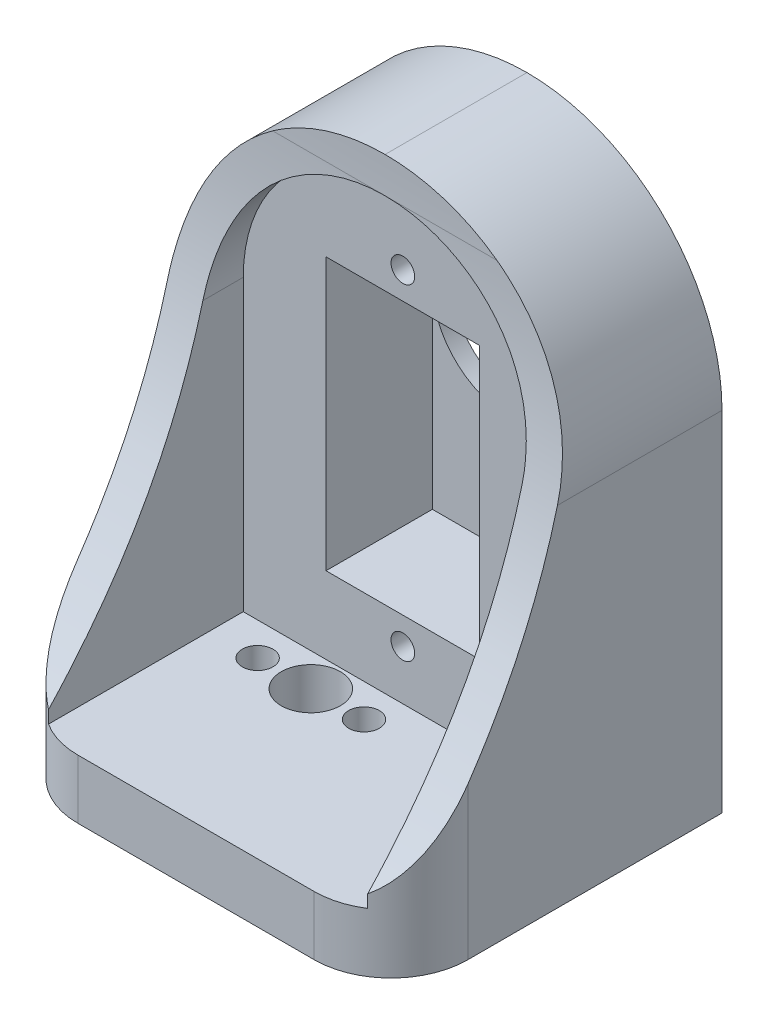
from build123d import *
from OCP.BRepAlgoAPI import BRepAlgoAPI_Cut
from OCP.TopTools import TopTools_ListOfShape

# Parameters (mm, degrees)
SKETCH1_W           = 33000
SKETCH1_H           = 28000
BOSS_EXTRUDE1_DEPTH = 46000
SKETCH2_W           = 17500
SKETCH2_H           = 41000
CUT_EXTRUDE1_DEPTH  = 46000
BOSS_EXTRUDE2_DEPTH = 3000
BOSS_EXTRUDE5_DEPTH = 27000
FILLET2_START       = -3500
FILLET2_DEPTH       = 3418.648482033
FILLET2_START_2     = -13500
FILLET2_2_DEPTH     = 27000
FILLET3_START       = -14000
FILLET3_DEPTH       = 13918.648482033
FILLET4_R           = 6500
SKETCH6_W           = 13000
SKETCH6_H           = 23000
CUT_EXTRUDE2_DEPTH  = 9000
SKETCH8_R           = 6500
CUT_EXTRUDE3_DEPTH  = 9000
SKETCH9_R           = 1000
CUT_EXTRUDE4_DEPTH  = 8000
SKETCH10_R          = 1300
SKETCH10_R_2        = 2500
CUT_EXTRUDE5_DEPTH  = 46361.004314511


with BuildPart() as part:
    # Sketch1 → Boss-Extrude1 (new body)
    with BuildSketch(Plane(origin=(0, 0, 0), x_dir=(1, 0, 0), z_dir=(0, 1, 0))):
        Rectangle(SKETCH1_W, SKETCH1_H)
    extrude(amount=BOSS_EXTRUDE1_DEPTH)

    # Sketch2 → Cut-Extrude1 (cut)
    with BuildSketch(Plane(origin=(16500, 0, 0), x_dir=(0, 0, -1), z_dir=(1, 0, 0))):
        with Locations((-5250, 25500)):
            Rectangle(SKETCH2_W, SKETCH2_H)
    extrude(amount=-CUT_EXTRUDE1_DEPTH, mode=Mode.SUBTRACT)

    # Sketch4 → Boss-Extrude2 (add)
    with BuildSketch(Plane(origin=(16500, 0, 0), x_dir=(0, 0, -1), z_dir=(1, 0, 0))):
        with BuildLine():
            Line((3500, 46000), (2000, 46000))
            add(Edge.make_bspline(
                [(-14000, 5000), (2293.563764944, 21561.018632043), (2000, 46000)],
                knots=[0, 0, 0, 1, 1, 1], degree=2))
            Line((-14000, 5000), (3500, 5000))
            Line((3500, 5000), (3500, 46000))
        make_face()
    boss_extrude2 = extrude(amount=-BOSS_EXTRUDE2_DEPTH)

    # Mirror1: Boss-Extrude2 across plane
    add(boss_extrude2.mirror(Plane(origin=(0, 0, 0), x_dir=(0, 0, 1), z_dir=(1, 0, 0))))

    # Sketch5 → Boss-Extrude5 (add)
    with BuildSketch(Plane.ZY.offset(-13500)):
        with BuildLine():
            Line((-3500, 46000), (-3500, 43000))
            Line((-3500, 43000), (-1972.645615255, 43000))
            add(Edge.make_bspline(
                [(-1972.645615255, 43000), (-2018.200029246, 44484.86009351), (-1999.999999994, 46000.00000052)],
                knots=[0.938003148, 0.938003148, 0.938003148, 1, 1, 1], degree=2))
            Line((-1999.999999994, 46000.00000052), (-3500, 46000))
        make_face()
    extrude(amount=BOSS_EXTRUDE5_DEPTH)

    # Fillet2: read off the stored shape, not the designer's step
    # Fillet2 outline → Fillet2 (add)
    with BuildSketch(Plane.XY.offset(FILLET2_START)):
        with BuildLine():
            ThreePointArc((-13500, 29500.000000001), (-9545.941546018, 39045.941546019), (0, 43000.000000001))
            Line((0, 43000.000000001), (-13500, 43000))
            Line((-13500, 43000), (-13500, 29500.000000001))
        make_face()
        with BuildLine():
            ThreePointArc((0, 43000), (9545.941546018, 39045.941546018), (13500, 29500))
            Line((13500, 29500), (13500, 43000))
            Line((13500, 43000), (0, 43000))
        make_face()
    extrude(amount=FILLET2_DEPTH)

    # Fillet2 2 outline → Fillet2 2 (cut)
    with BuildSketch(Plane.YZ.offset(FILLET2_START_2)):
        with BuildLine():
            add(Edge.make_bspline(
                [(43000.000000001, -1972.645615255), (35904.261861738, -1754.953595558), (29499.999999976, -81.351518061)],
                knots=[0.061996852, 0.061996852, 0.061996852, 0.358262761, 0.358262761, 0.358262761], degree=2))
            Line((43000.000000001, -1972.645615255), (43000.000000001, -81.351517967))
            Line((43000.000000001, -81.351517967), (29499.999999976, -81.351518061))
        make_face()
    extrude(amount=FILLET2_2_DEPTH, mode=Mode.SUBTRACT)


with BuildPart() as fillet3_tool:
    # Fillet3: read off the stored shape, not the designer's step
    # Fillet3 outline → Fillet3 (new body)
    with BuildSketch(Plane.XY.offset(FILLET3_START)):
        with BuildLine():
            Line((-16500, 46000), (-16500, 29500))
            ThreePointArc((-16500, 29500), (-11667.261889578, 41167.261889578), (0, 46000))
            Line((0, 46000), (-16500, 46000))
        make_face()
        with BuildLine():
            Line((16500, 46000), (0, 46000))
            ThreePointArc((0, 46000), (11667.261889578, 41167.261889578), (16500, 29500))
            Line((16500, 29500), (16500, 46000))
        make_face()
    extrude(amount=FILLET3_DEPTH)


with BuildPart() as part_1:
    add(part.part)

    # Fillet3: cut by fillet3_tool, with a tolerance
    fillet3_stock = TopTools_ListOfShape()
    fillet3_stock.Append(part_1.part.wrapped)
    fillet3_tools = TopTools_ListOfShape()
    fillet3_tools.Append(fillet3_tool.part.wrapped)
    fillet3_cut = BRepAlgoAPI_Cut()
    fillet3_cut.SetArguments(fillet3_stock)
    fillet3_cut.SetTools(fillet3_tools)
    fillet3_cut.SetFuzzyValue(0.00001)
    fillet3_cut.Build()
    add(Compound.cast(fillet3_cut.Shape()).solids(), mode=Mode.REPLACE)

    # Fillet4
    # the kernel refuses this fillet: 6500 mm, written as the material it takes off along each edge
    with BuildSketch(Plane(origin=(16500, -16250, 14000), x_dir=(0, 0, -1), z_dir=(0, 1, 0)), Plane(origin=(-16500, -16250, 14000), x_dir=(1, 0, 0), z_dir=(0, 1, 0))) as fillet4_piece_1:
        with BuildLine():
            CenterArc((FILLET4_R, FILLET4_R), FILLET4_R, 180, 90)
            Line((0, FILLET4_R), (0, 0))
            Line((0, 0), (FILLET4_R, 0))
        make_face()
    extrude(amount=37500, mode=Mode.SUBTRACT)

    # Sketch6 → Cut-Extrude2 (cut)
    with BuildSketch(Plane.XY.offset(-3500)):
        with Locations((0, 23000)):
            Rectangle(SKETCH6_W, SKETCH6_H)
    extrude(amount=-CUT_EXTRUDE2_DEPTH, mode=Mode.SUBTRACT)

    # Sketch8 → Cut-Extrude3 (cut)
    with BuildSketch(Plane.XY.offset(-12500)):
        with Locations((0, 28000)):
            Circle(SKETCH8_R)
    extrude(amount=-CUT_EXTRUDE3_DEPTH, mode=Mode.SUBTRACT)

    # Sketch9 → Cut-Extrude4 (cut)
    with BuildSketch(Plane.XY.offset(-3500)):
        with Locations((0, 36800)):
            Circle(SKETCH9_R)
        with Locations((0, 9200)):
            Circle(SKETCH9_R)
    extrude(amount=-CUT_EXTRUDE4_DEPTH, mode=Mode.SUBTRACT)

    # Sketch10 → Cut-Extrude5 (cut, through all)
    with BuildSketch(Plane(origin=(0, 5000, 0), x_dir=(1, 0, 0), z_dir=(0, 1, 0))):
        with Locations(Location((-500, 714.02126318, 0), (0, 0, 270))):
            Circle(SKETCH10_R)
        with Locations(Location((-5000, 714.02126318, 0), (0, 0, 270))):
            Circle(SKETCH10_R_2)
        with Locations(Location((-9500, 714.02126318, 0), (0, 0, 270))):
            Circle(SKETCH10_R)
    extrude(amount=-CUT_EXTRUDE5_DEPTH, mode=Mode.SUBTRACT)


solid = part_1.part
